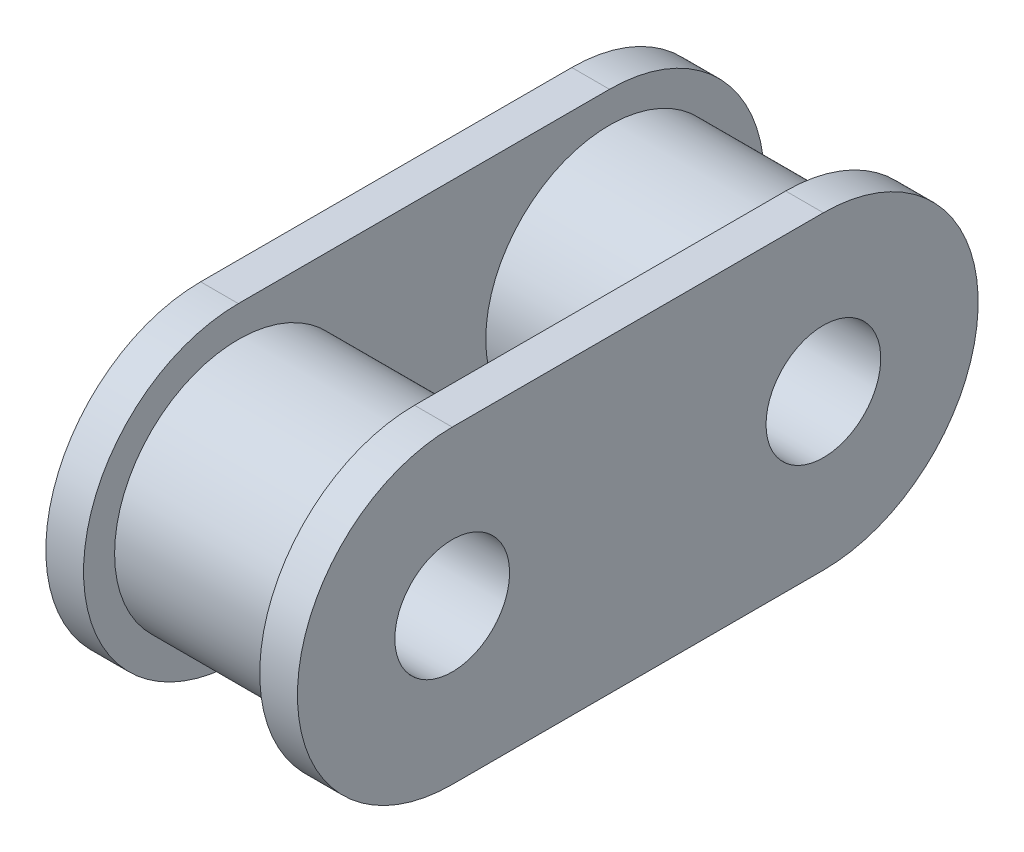
from build123d import *

# Parameters (mm, degrees)
SKETCH1_R               = 0.9271
BOSS_EXTRUDE1_DEPTH     = 1.424
BOSS_EXTRUDE2_OUTLINE_R = 0.9271
BOSS_EXTRUDE2_DEPTH     = 0.6096
CUT_EXTRUDE2_START      = -1.424
SKETCH3_R               = 2
CUT_EXTRUDE2_DEPTH      = 2.848


# Read off the part's stored shape, not the designer's step: Boss-Extrude2
with BuildPart() as part:
    # Sketch1 → Boss-Extrude1 (new, symmetric)
    with BuildSketch(Plane(origin=(0, 0, 0), x_dir=(0, 0, -1), z_dir=(1, 0, 0))):
        with BuildLine():
            Line((-3, 2), (3, 2))
            ThreePointArc((3, 2), (5, 0), (3, -2))
            Line((3, -2), (-3, -2))
            ThreePointArc((-3, -2), (-5, 0), (-3, 2))
        make_face()
        with Locations(Location((-3, 0, 0), (0, 0, 180))):
            Circle(SKETCH1_R, mode=Mode.SUBTRACT)
        with Locations(Location((3, 0, 0), (0, 0, 180))):
            Circle(SKETCH1_R, mode=Mode.SUBTRACT)
    extrude(amount=BOSS_EXTRUDE1_DEPTH, both=True)

    # Boss-Extrude2 outline → Boss-Extrude2 (add)
    with BuildSketch(Plane(origin=(1.424, 0, 0), x_dir=(0, 0, -1), z_dir=(1, 0, 0))):
        with BuildLine():
            Line((-3, -2.5019), (3, -2.5019))
            ThreePointArc((3, -2.5019), (5.5019, 0), (3, 2.5019))
            Line((3, 2.5019), (-3, 2.5019))
            ThreePointArc((-3, 2.5019), (-5.5019, 0), (-3, -2.5019))
        make_face()
        with Locations((-3, 0)):
            Circle(BOSS_EXTRUDE2_OUTLINE_R, mode=Mode.SUBTRACT)
        with Locations((3, 0)):
            Circle(BOSS_EXTRUDE2_OUTLINE_R, mode=Mode.SUBTRACT)
    boss_extrude2 = extrude(amount=BOSS_EXTRUDE2_DEPTH)

    # Mirror1: Boss-Extrude2 across plane
    add(boss_extrude2.mirror(Plane(origin=(0, 0, 0), x_dir=(0, 0, 1), z_dir=(1, 0, 0))))

    # Sketch3 → Cut-Extrude2 (cut)
    with BuildSketch(Plane(origin=(0, 0, 0), x_dir=(0, 0, -1), z_dir=(1, 0, 0)).offset(CUT_EXTRUDE2_START)):
        with BuildLine():
            Line((-3, 2.5019), (3, 2.5019))
            ThreePointArc((3, 2.5019), (5.5019, 0), (3, -2.5019))
            Line((3, -2.5019), (-3, -2.5019))
            ThreePointArc((-3, -2.5019), (-5.5019, 0), (-3, 2.5019))
        make_face()
        with Locations(Location((-3, 0, 0), (0, 0, 180))):
            Circle(SKETCH3_R, mode=Mode.SUBTRACT)
        with Locations(Location((3, 0, 0), (0, 0, 180))):
            Circle(SKETCH3_R, mode=Mode.SUBTRACT)
    extrude(amount=CUT_EXTRUDE2_DEPTH, mode=Mode.SUBTRACT)


solid = part.part
